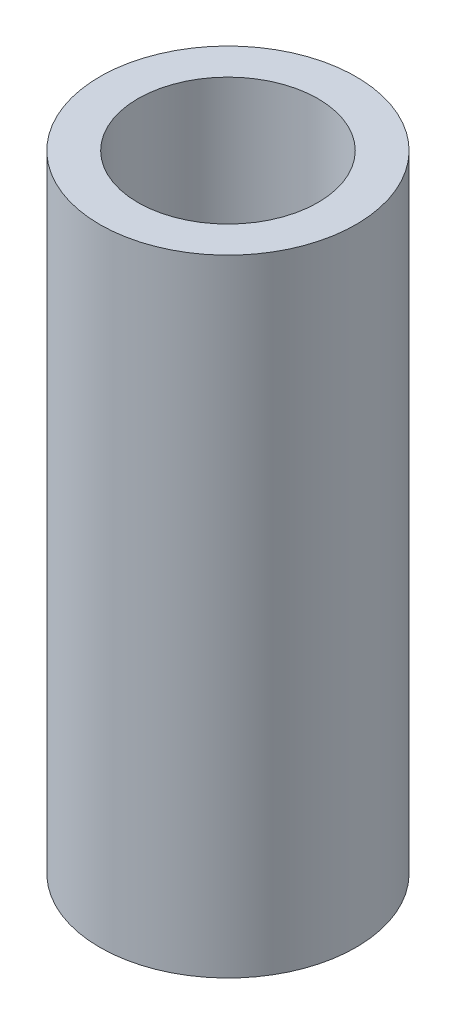
from build123d import *

# Parameters (mm, degrees)
SKETCH1_R           = 32.5
BOSS_EXTRUDE1_DEPTH = 158.822481335
SKETCH2_R           = 22.840260763
CUT_EXTRUDE1_DEPTH  = 166.339289273


with BuildPart() as part:
    # Sketch1 → Boss-Extrude1 (new body)
    with BuildSketch(Plane(origin=(0, 0, 0), x_dir=(1, 0, 0), z_dir=(0, 1, 0))):
        Circle(SKETCH1_R)
    extrude(amount=BOSS_EXTRUDE1_DEPTH)

    # Sketch2 → Cut-Extrude1 (cut, through all)
    with BuildSketch(Plane(origin=(0, 0, 0), x_dir=(1, 0, 0), z_dir=(0, 1, 0))):
        Circle(SKETCH2_R)
    extrude(amount=CUT_EXTRUDE1_DEPTH, mode=Mode.SUBTRACT)


solid = part.part
